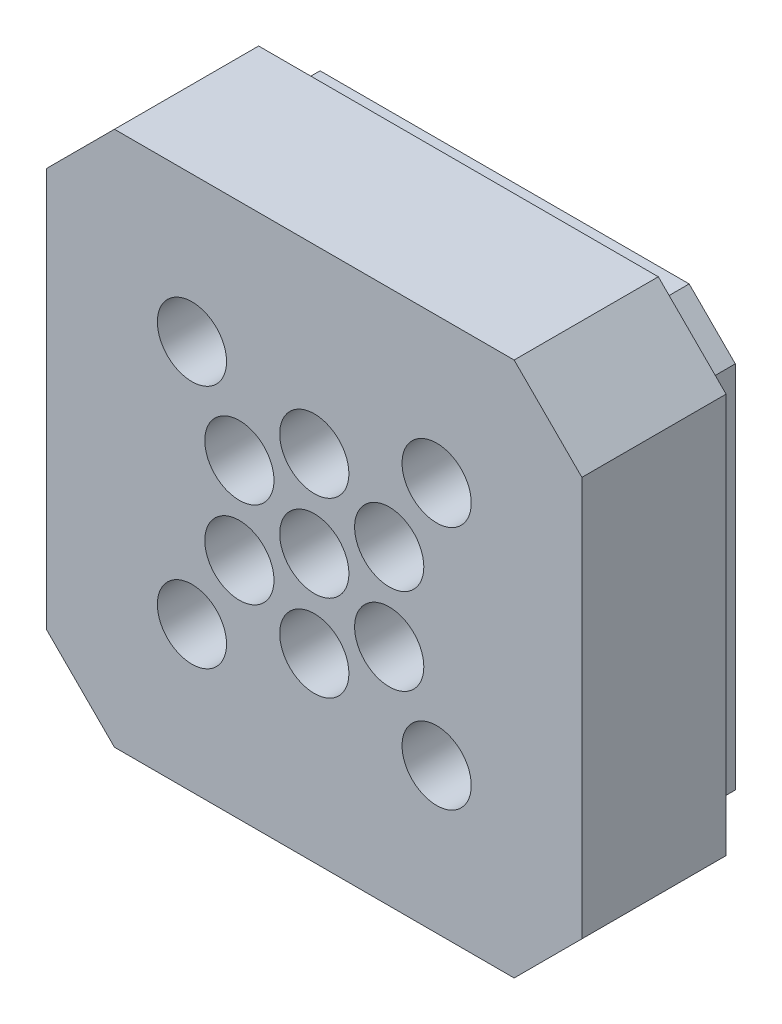
from build123d import *

# Parameters (mm, degrees)
SKETCH1_W                                            = 40
SKETCH1_H                                            = 40
BOSS_EXTRUDE1_DEPTH                                  = 10
F_6_0MM_DOWEL_HOLE1_D                                = 6
CSK_FOR_M3_HEX_SOCKET_COUNTERSUNK_HEAD_S_D           = 3.4
CSK_FOR_M3_HEX_SOCKET_COUNTERSUNK_HEAD_S_CSINK_D     = 6.94
CSK_FOR_M3_HEX_SOCKET_COUNTERSUNK_HEAD_S_CSINK_ANGLE = 90
TAP_DRILL_FOR_M4_TAP1_D                              = 3.3
CHAMFER1_SIZE                                        = 4
CHAMFER2_SIZE                                        = 0.6
BOSS_EXTRUDE2_DEPTH                                  = 6
BOSS_EXTRUDE3_DEPTH                                  = 6.5
F_6_0MM_DOWEL_HOLE2_AT_2_COUNT                       = 2
F_6_0MM_DOWEL_HOLE2_AT_2_PITCH                       = 21.213203436
F_6_0MM_DOWEL_HOLE2_AT_3_COUNT                       = 2
F_6_0MM_DOWEL_HOLE2_AT_3_PITCH                       = 11.052193187
F_6_0MM_DOWEL_HOLE2_AT_4_COUNT                       = 2
F_6_0MM_DOWEL_HOLE2_AT_4_PITCH                       = 7.994791372
F_6_0MM_DOWEL_HOLE2_AT_5_COUNT                       = 2
F_6_0MM_DOWEL_HOLE2_AT_5_PITCH                       = 14.933710686
F_6_0MM_DOWEL_HOLE2_AT_6_COUNT                       = 2
F_6_0MM_DOWEL_HOLE2_AT_6_PITCH                       = 21.213203436
F_6_0MM_DOWEL_HOLE2_AT_7_COUNT                       = 2
F_6_0MM_DOWEL_HOLE2_AT_7_PITCH                       = 30
F_6_0MM_DOWEL_HOLE2_AT_8_COUNT                       = 2
F_6_0MM_DOWEL_HOLE2_AT_8_PITCH                       = 18.425099325
F_6_0MM_DOWEL_HOLE2_AT_9_COUNT                       = 2
F_6_0MM_DOWEL_HOLE2_AT_9_PITCH                       = 22.328979173
F_6_0MM_DOWEL_HOLE2_AT_10_COUNT                      = 2
F_6_0MM_DOWEL_HOLE2_AT_10_PITCH                      = 20.984494889
F_6_0MM_DOWEL_HOLE2_AT_11_COUNT                      = 2
F_6_0MM_DOWEL_HOLE2_AT_11_PITCH                      = 15


with BuildPart() as part:
    # Sketch1 → Boss-Extrude1 (new body)
    with BuildSketch(Plane.XY):
        with Locations((20, 20)):
            Rectangle(SKETCH1_W, SKETCH1_H)
    extrude(amount=BOSS_EXTRUDE1_DEPTH)

    # Ø6.0mm Dowel Hole1 (through all)
    with Locations(Plane.XY.offset(10)):
        with Locations((20, 20)):
            Hole(F_6_0MM_DOWEL_HOLE1_D / 2)

    # CSK for M3 Hex Socket Countersunk Head Screw1 (through all)
    with Locations(Plane.XY.offset(10)):
        with Locations((20, 27.5), (26.495190528, 23.75), (26.495190528, 16.25), (20, 12.5), (13.504809472, 16.25), (13.504809472, 23.75)):
            CounterSinkHole(CSK_FOR_M3_HEX_SOCKET_COUNTERSUNK_HEAD_S_D / 2, CSK_FOR_M3_HEX_SOCKET_COUNTERSUNK_HEAD_S_CSINK_D / 2, counter_sink_angle=CSK_FOR_M3_HEX_SOCKET_COUNTERSUNK_HEAD_S_CSINK_ANGLE)

    # Tap Drill for M4 Tap1 (through all)
    with Locations(Plane.XY.offset(10)):
        with Locations((9.393398282, 30.606601718), (30.606601718, 30.606601718), (30.606601718, 9.393398282), (9.393398282, 9.393398282)):
            Hole(TAP_DRILL_FOR_M4_TAP1_D / 2)

    # Chamfer1
    chamfer1_edges = [part.edges().sort_by_distance(p)[0] for p in [
        (40, 0, 5),
        (40, 40, 5),
        (0, 0, 5),
        (0, 40, 5),
    ]]
    chamfer(chamfer1_edges, length=CHAMFER1_SIZE)

    # Chamfer2
    chamfer2_edges = [part.edges().sort_by_distance(p)[0] for p in [
        (40, 20, 10),
        (38, 38, 10),
        (38, 2, 10),
        (20, 0, 10),
        (2, 2, 10),
        (0, 20, 10),
        (2, 38, 10),
        (20, 40, 10),
    ]]
    chamfer(chamfer2_edges, length=CHAMFER2_SIZE)


with BuildPart() as body_2:
    # Sketch19 → Boss-Extrude2 (new body)
    with BuildSketch(Plane.XY.offset(10)):
        Polygon((43.2, 2.6745166), (43.2, 37.3254834), (37.3254834, 43.2), (2.6745166, 43.2), (-3.2, 37.3254834), (-3.2, 2.6745166), (2.6745166, -3.2), (37.3254834, -3.2), align=None)
        Polygon((40.2, 3.917157288), (40.2, 36.082842712), (36.082842712, 40.2), (3.917157288, 40.2), (-0.2, 36.082842712), (-0.2, 3.917157288), (3.917157288, -0.2), (36.082842712, -0.2), align=None, mode=Mode.SUBTRACT)
    extrude(amount=-BOSS_EXTRUDE2_DEPTH)

    # Sketch20 → Boss-Extrude3 (add)
    with BuildSketch(Plane.XY.offset(10)):
        Polygon((37.3254834, -3.2), (43.2, 2.6745166), (43.2, 37.3254834), (37.3254834, 43.2), (2.6745166, 43.2), (-3.2, 37.3254834), (-3.2, 2.6745166), (2.6745166, -3.2), align=None)
    extrude(amount=BOSS_EXTRUDE3_DEPTH)

    # Sketch22 → Ø6.0mm Dowel Hole2 (revolve, cut)
    with BuildSketch(Plane(origin=(30.606601718, 30.606601718, 16.5), x_dir=(0, -1, 0), z_dir=(1, 0, 0))):
        Polygon((0, 0), (0, 8.302581857), (3, 6.5), (3, 0), align=None)
    f_6_0mm_dowel_hole2 = revolve(axis=Axis((30.606601718, 30.606601718, 22.85), (0, 0, -1)), mode=Mode.SUBTRACT)

    # Ø6.0mm Dowel Hole2 at 2: Ø6.0mm Dowel Hole2 ×2
    with Locations(*[(-i * F_6_0MM_DOWEL_HOLE2_AT_2_PITCH, 0, 0) for i in range(1, F_6_0MM_DOWEL_HOLE2_AT_2_COUNT)]):
        add(f_6_0mm_dowel_hole2, mode=Mode.SUBTRACT)

    # Ø6.0mm Dowel Hole2 at 3: Ø6.0mm Dowel Hole2 ×2
    with Locations(*[Vector(-0.9596829822606595, -0.2810846377148472, 0) * (i * F_6_0MM_DOWEL_HOLE2_AT_3_PITCH) for i in range(1, F_6_0MM_DOWEL_HOLE2_AT_3_COUNT)]):
        add(f_6_0mm_dowel_hole2, mode=Mode.SUBTRACT)

    # Ø6.0mm Dowel Hole2 at 4: Ø6.0mm Dowel Hole2 ×2
    with Locations(*[Vector(-0.5142612230899398, -0.857633601502436, 0) * (i * F_6_0MM_DOWEL_HOLE2_AT_4_PITCH) for i in range(1, F_6_0MM_DOWEL_HOLE2_AT_4_COUNT)]):
        add(f_6_0mm_dowel_hole2, mode=Mode.SUBTRACT)

    # Ø6.0mm Dowel Hole2 at 5: Ø6.0mm Dowel Hole2 ×2
    with Locations(*[Vector(-0.275310756708365, -0.9613552866868041, 0) * (i * F_6_0MM_DOWEL_HOLE2_AT_5_PITCH) for i in range(1, F_6_0MM_DOWEL_HOLE2_AT_5_COUNT)]):
        add(f_6_0mm_dowel_hole2, mode=Mode.SUBTRACT)

    # Ø6.0mm Dowel Hole2 at 6: Ø6.0mm Dowel Hole2 ×2
    with Locations(*[(0, -i * F_6_0MM_DOWEL_HOLE2_AT_6_PITCH, 0) for i in range(1, F_6_0MM_DOWEL_HOLE2_AT_6_COUNT)]):
        add(f_6_0mm_dowel_hole2, mode=Mode.SUBTRACT)

    # Ø6.0mm Dowel Hole2 at 7: Ø6.0mm Dowel Hole2 ×2
    with Locations(*[Vector(-0.7071067811865323, -0.7071067811865628, 0) * (i * F_6_0MM_DOWEL_HOLE2_AT_7_PITCH) for i in range(1, F_6_0MM_DOWEL_HOLE2_AT_7_COUNT)]):
        add(f_6_0mm_dowel_hole2, mode=Mode.SUBTRACT)

    # Ø6.0mm Dowel Hole2 at 8: Ø6.0mm Dowel Hole2 ×2
    with Locations(*[Vector(-0.9281791074350354, -0.3721337723468552, 0) * (i * F_6_0MM_DOWEL_HOLE2_AT_8_PITCH) for i in range(1, F_6_0MM_DOWEL_HOLE2_AT_8_COUNT)]):
        add(f_6_0mm_dowel_hole2, mode=Mode.SUBTRACT)

    # Ø6.0mm Dowel Hole2 at 9: Ø6.0mm Dowel Hole2 ×2
    with Locations(*[Vector(-0.7659012135559089, -0.6429582654213151, 0) * (i * F_6_0MM_DOWEL_HOLE2_AT_9_PITCH) for i in range(1, F_6_0MM_DOWEL_HOLE2_AT_9_COUNT)]):
        add(f_6_0mm_dowel_hole2, mode=Mode.SUBTRACT)

    # Ø6.0mm Dowel Hole2 at 10: Ø6.0mm Dowel Hole2 ×2
    with Locations(*[Vector(-0.5054494651244305, -0.8628562094610128, 0) * (i * F_6_0MM_DOWEL_HOLE2_AT_10_PITCH) for i in range(1, F_6_0MM_DOWEL_HOLE2_AT_10_COUNT)]):
        add(f_6_0mm_dowel_hole2, mode=Mode.SUBTRACT)

    # Ø6.0mm Dowel Hole2 at 11: Ø6.0mm Dowel Hole2 ×2
    with Locations(*[Vector(-0.7071067811865477, -0.7071067811865475, 0) * (i * F_6_0MM_DOWEL_HOLE2_AT_11_PITCH) for i in range(1, F_6_0MM_DOWEL_HOLE2_AT_11_COUNT)]):
        add(f_6_0mm_dowel_hole2, mode=Mode.SUBTRACT)


solid = Compound([part.part, body_2.part])
